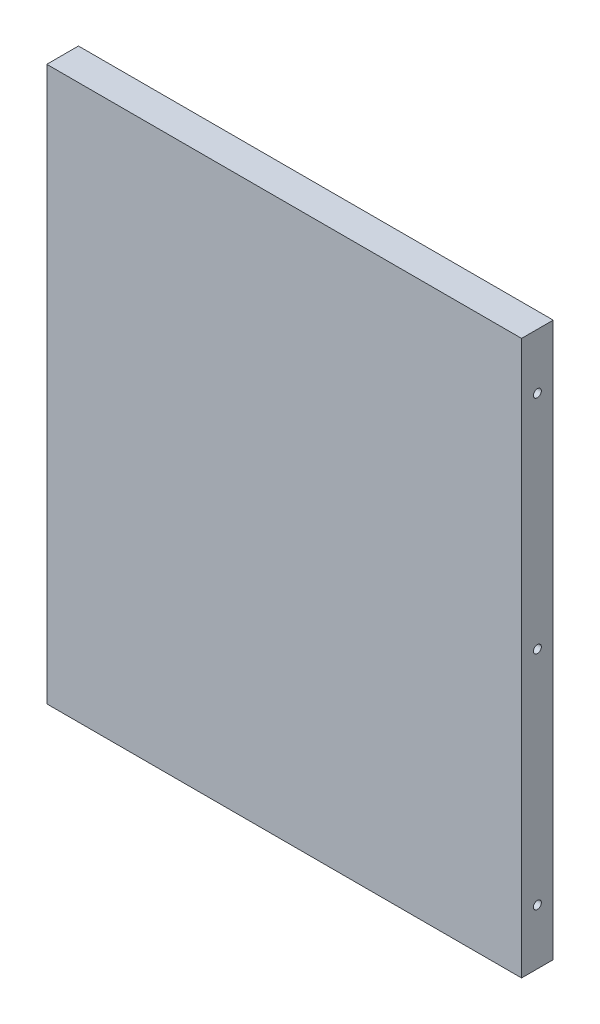
from build123d import *

# Parameters (mm, degrees)
SKIZZE1_W                       = 150
SKIZZE1_H                       = 175
AUFSATZ_LINEAR_AUSTRAGEN1_DEPTH = 10
SKIZZE2_R                       = 1.25
SCHNITT_LINEAR_AUSTRAGEN1_DEPTH = 5
SCHNITT_LINEAR_START            = -5
SKIZZE3_R                       = 1.25
SCHNITT_LINEAR_AUSTRAGEN2_DEPTH = 5


with BuildPart() as part:
    # Skizze1 → Aufsatz-Linear austragen1 (new body)
    with BuildSketch(Plane.XY):
        with Locations((-9.70090245, -21.923076923)):
            Rectangle(SKIZZE1_W, SKIZZE1_H)
    extrude(amount=AUFSATZ_LINEAR_AUSTRAGEN1_DEPTH)

    # Skizze2 → Schnitt-Linear austragen1 (cut)
    with BuildSketch(Plane.ZY.offset(84.70090245)):
        with Locations((5, 48.076923077)):
            Circle(SKIZZE2_R)
        with Locations((5, -21.923076923)):
            Circle(SKIZZE2_R)
        with Locations((5, -91.923076923)):
            Circle(SKIZZE2_R)
    extrude(amount=-SCHNITT_LINEAR_AUSTRAGEN1_DEPTH, mode=Mode.SUBTRACT)

    # Skizze3 → Schnitt-Linear austragen2 (cut)
    with BuildSketch(Plane(origin=(65.29909755, 0, 0), x_dir=(0, 0, -1), z_dir=(1, 0, 0)).offset(SCHNITT_LINEAR_START)):
        with Locations((-5, 48.076923077)):
            Circle(SKIZZE3_R)
        with Locations((-5, -21.923076923)):
            Circle(SKIZZE3_R)
        with Locations((-5, -91.923076923)):
            Circle(SKIZZE3_R)
    extrude(amount=SCHNITT_LINEAR_AUSTRAGEN2_DEPTH, mode=Mode.SUBTRACT)


solid = part.part
